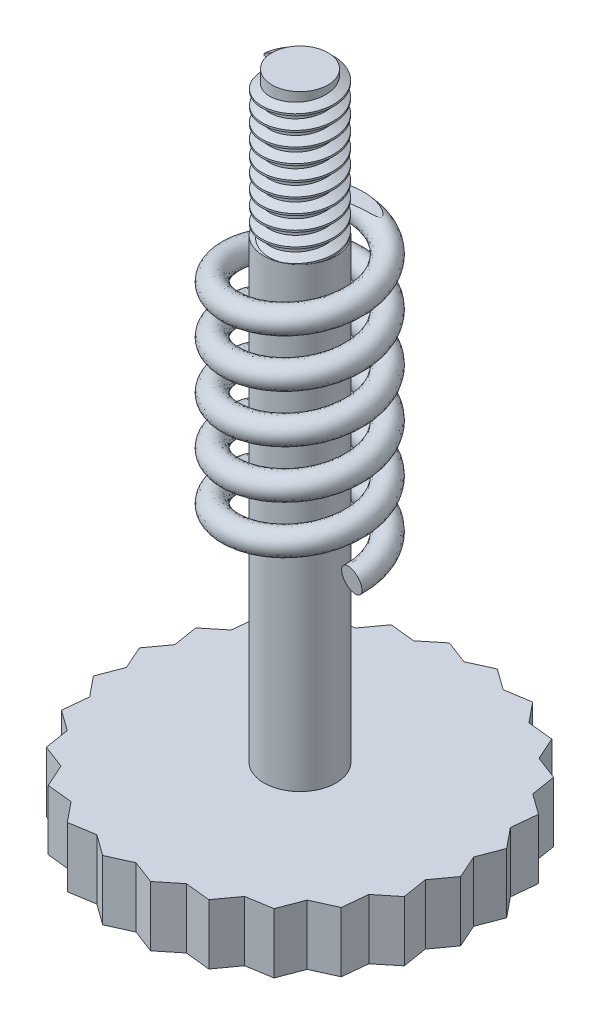
from build123d import *

# Parameters (mm, degrees)
BOSS_EXTRUDE1_DEPTH           = 2.5
SKETCH2_R                     = 1.5
BOSS_EXTRUDE2_DEPTH           = 25
CUT_EXTRUDE1_START            = -6
SKETCH21_R                    = 1.5
SKETCH21_R_2                  = 1.165
CUT_EXTRUDE1_DEPTH            = 6
MINCOLWIDTH_ONTRACKING2_PITCH = 0.6
SWEEP1_PITCH                  = 2
SWEEP1_HEIGHT                 = 10.8
SWEEP1_RADIUS                 = 2.25
SWEEP1_START_ANGLE            = -45
SKETCH23_R                    = 0.5
SKETCH24_R                    = 4.946709619
SKETCH24_R_2                  = 1.5
CUT_EXTRUDE2_DEPTH            = 10


with BuildPart() as part:
    # Sketch1 → Boss-Extrude1 (new body)
    with BuildSketch(Plane(origin=(0, 0, 0), x_dir=(1, 0, 0), z_dir=(0, 1, 0))):
        Polygon((5.820994377, 4.738075326), (4.835937883, 5.113358965), (4.406346406, 6.075972735), (3.345442129, 6.18654114), (2.672091343, 7.013790786), (1.614479573, 6.843549606), (0.744473007, 7.468540237), (-0.21202342, 7.036514946), (-1.192796409, 7.410166669), (-2.010329821, 6.74472454), (-3.058773539, 6.853994293), (-3.684980724, 5.99050844), (-4.738075326, 5.820994377), (-5.119448024, 4.819955127), (-6.095709071, 4.379002655), (-6.199812407, 3.334639805), (-7.013790786, 2.672091343), (-6.846267704, 1.631365575), (-7.465119945, 0.778021558), (-7.030422853, -0.1960327), (-7.410166669, -1.192796409), (-6.733927597, -2.023594479), (-6.840182078, -3.089537582), (-5.987788987, -3.70187514), (-5.820994377, -4.738075326), (-4.835937883, -5.113358965), (-4.406346406, -6.075972735), (-3.345442129, -6.18654114), (-2.672091343, -7.013790786), (-1.614479573, -6.843549606), (-0.744473007, -7.468540237), (0.21202342, -7.036514946), (1.192796409, -7.410166669), (2.010329821, -6.74472454), (3.058773539, -6.853994293), (3.684980724, -5.99050844), (4.738075326, -5.820994377), (5.119448024, -4.819955127), (6.095709071, -4.379002655), (6.199812407, -3.334639805), (7.013790786, -2.672091343), (6.846267704, -1.631365575), (7.465119945, -0.778021558), (7.030422853, 0.1960327), (7.410166669, 1.192796409), (6.733927597, 2.023594479), (6.840182078, 3.089537582), (5.987788987, 3.70187514), align=None)
    extrude(amount=BOSS_EXTRUDE1_DEPTH)

    # Sketch2 → Boss-Extrude2 (add)
    with BuildSketch(Plane(origin=(0, 2.5, 0), x_dir=(1, 0, 0), z_dir=(0, 1, 0))):
        with Locations(Location((0, 0, 0), (0, 0, 270))):
            Circle(SKETCH2_R)
    extrude(amount=BOSS_EXTRUDE2_DEPTH)

    # Sketch21 → Cut-Extrude1 (cut)
    with BuildSketch(Plane(origin=(0, 27.5, 0), x_dir=(1, 0, 0), z_dir=(0, 1, 0)).offset(CUT_EXTRUDE1_START)):
        with Locations(Location((0, 0, 0), (0, 0, 270))):
            Circle(SKETCH21_R)
        with Locations(Location((0, 0, 0), (0, 0, 270))):
            Circle(SKETCH21_R_2, mode=Mode.SUBTRACT)
    extrude(amount=CUT_EXTRUDE1_DEPTH, mode=Mode.SUBTRACT)

    # MinColWidth_OnTracking2: the profile of HeaderRowsCount4 profile screwed along a right-hand helix of 10 turns, 6 arcs to a turn; built about Z, then put on its axis
    mincolwidth_ontracking2_z = Axis((0, 0, 0), (0, 0, 1))
    mincolwidth_ontracking2_corners = [(1.1647, 0, -0.000173205), (1.489759525, 0, 0.187499999), (1.489759525, 0, 0.262499999), (1.1647, 0, 0.450173203)]
    with BuildLine(mode=Mode.PRIVATE) as mincolwidth_ontracking2_profile:
        Line(mincolwidth_ontracking2_corners[0], mincolwidth_ontracking2_corners[1])
        Line(mincolwidth_ontracking2_corners[1], mincolwidth_ontracking2_corners[2])
        Line(mincolwidth_ontracking2_corners[2], mincolwidth_ontracking2_corners[3])
        Line(mincolwidth_ontracking2_corners[3], mincolwidth_ontracking2_corners[0])
    mincolwidth_ontracking2_cap = Face(mincolwidth_ontracking2_profile.wire())
    mincolwidth_ontracking2_turn_angles = [0, 30, 60, 90, 120, 150, 180, 210, 240, 270, 300, 330, 360]
    mincolwidth_ontracking2_turn_weights = [1, 0.8660254037844387, 1, 0.8660254037844387, 1, 0.8660254037844387, 1, 0.8660254037844387, 1, 0.8660254037844387, 1, 0.8660254037844387, 1]
    mincolwidth_ontracking2_turn_rails = [Edge.make_bspline([Vector(p[0], p[1], 0).rotate(mincolwidth_ontracking2_z, mincolwidth_ontracking2_turn_angles[k]) / mincolwidth_ontracking2_turn_weights[k] + Vector(0, 0, p[2] + MINCOLWIDTH_ONTRACKING2_PITCH * mincolwidth_ontracking2_turn_angles[k] / 360) for k in range(13)], [0, 0, 0, 1, 1, 2, 2, 3, 3, 4, 4, 5, 5, 6, 6, 6], 2, mincolwidth_ontracking2_turn_weights) for p in mincolwidth_ontracking2_corners]
    mincolwidth_ontracking2_turn_sides = [Face.make_surface_from_curves(mincolwidth_ontracking2_turn_rails[p[0]], mincolwidth_ontracking2_turn_rails[p[1]]) for p in [(0, 1), (1, 2), (2, 3), (3, 0)]]
    mincolwidth_ontracking2 = Plane(origin=(0, 27.5, 0), x_dir=(-1, 0, 0), z_dir=(0, -1, 0)) * Solid(Shell([*[p.moved(Location((0, 0, MINCOLWIDTH_ONTRACKING2_PITCH * i))) for i in range(10) for p in mincolwidth_ontracking2_turn_sides], mincolwidth_ontracking2_cap, mincolwidth_ontracking2_cap.rotate(mincolwidth_ontracking2_z, 3600).moved(Location((0, 0, MINCOLWIDTH_ONTRACKING2_PITCH * 3600 / 360)))]))
    add(mincolwidth_ontracking2)


with BuildPart() as body_2:
    # Sweep1: sweep along a helix
    with BuildLine() as sweep1_path:
        add(Helix(SWEEP1_PITCH, SWEEP1_HEIGHT, SWEEP1_RADIUS, center=(0.035218552, 21.5, 0.044883087), direction=(0, -1, 0), mode=Mode.PRIVATE).rotate(Axis((0.035218552, 21.5, 0.044883087), (0, -1, 0)), SWEEP1_START_ANGLE))
    # Sketch23 → Sweep1 (sweep)
    with BuildSketch(Plane(origin=(2.257517318, 10.7, 0.396860633), x_dir=(0.9879313877760916, -0.021961758332692358, 0.15332727812669986), z_dir=(-0.15489213358594411, -0.14007625749167685, 0.9779504430390733))):
        with Locations((0.334368827, -0.118026662)):
            Circle(SKETCH23_R)
    sweep(path=sweep1_path.line, is_frenet=True)

    # Sketch24 → Cut-Extrude2 (cut)
    with BuildSketch(Plane(origin=(0, 21.5, 0), x_dir=(1, 0, 0), z_dir=(0, 1, 0))):
        with Locations((0.01826176, 0)):
            Circle(SKETCH24_R)
        with Locations(Location((0, 0, 0), (0, 0, 270))):
            Circle(SKETCH24_R_2, mode=Mode.SUBTRACT)
    extrude(amount=CUT_EXTRUDE2_DEPTH, mode=Mode.SUBTRACT)


solid = Compound([part.part, body_2.part])
